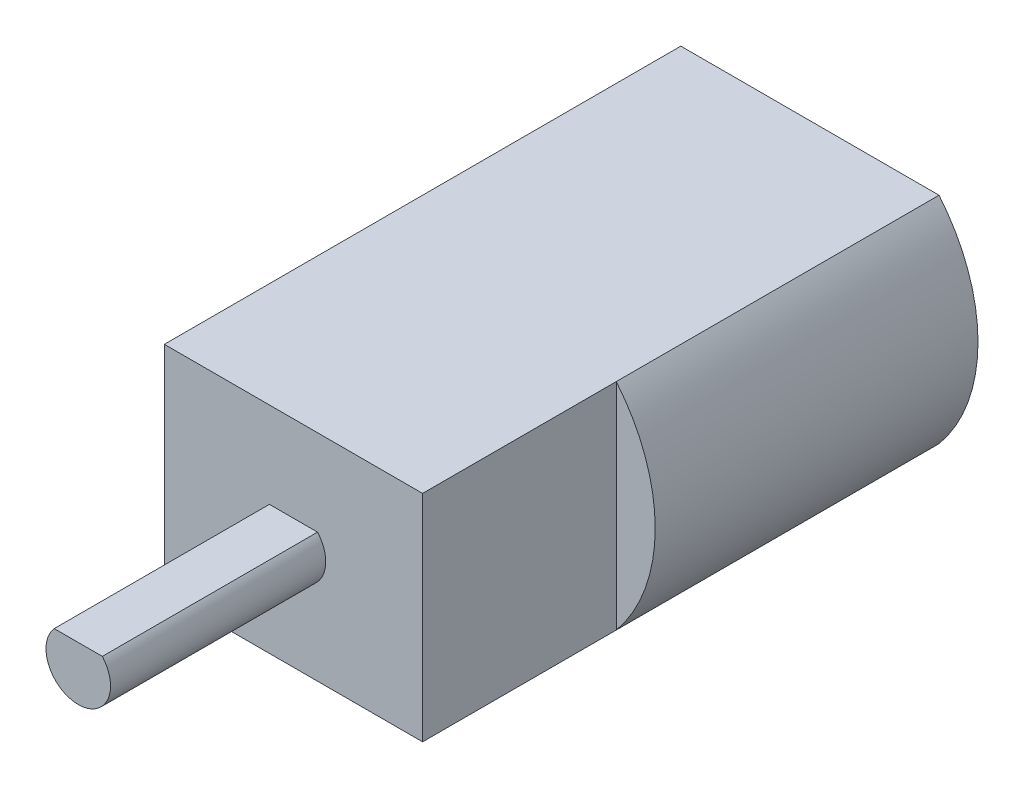
from build123d import *

# Parameters (mm, degrees)
BOSS_EXTRUDE1_DEPTH = 15
SKETCH1_3_R         = 2.5
BOSS_EXTRUDE2_DEPTH = 1
SKETCH2_W           = 12
SKETCH2_H           = 10
BOSS_EXTRUDE3_DEPTH = 9
BOSS_EXTRUDE4_DEPTH = 10


with BuildPart() as part:
    # Sketch1 → Boss-Extrude1 (new body)
    with BuildSketch(Plane.XY):
        with BuildLine():
            Line((-6, 5), (6, 5))
            ThreePointArc((6, 5), (7.810249676, 0), (6, -5))
            Line((6, -5), (-6, -5))
            ThreePointArc((-6, -5), (-7.810249676, 0), (-6, 5))
        make_face()
    extrude(amount=BOSS_EXTRUDE1_DEPTH)

    # Sketch1<3> → Boss-Extrude2 (add)
    with BuildSketch(Plane.XY):
        Circle(SKETCH1_3_R)
    extrude(amount=-BOSS_EXTRUDE2_DEPTH)

    # Sketch2 → Boss-Extrude3 (add)
    with BuildSketch(Plane.XY.offset(15)):
        Rectangle(SKETCH2_W, SKETCH2_H)
    extrude(amount=BOSS_EXTRUDE3_DEPTH)

    # Sketch3 → Boss-Extrude4 (add)
    with BuildSketch(Plane.XY.offset(24)):
        with BuildLine():
            Line((-1.118033989, 1), (1.118033989, 1))
            ThreePointArc((1.118033989, 1), (0, -1.5), (-1.118033989, 1))
        make_face()
    extrude(amount=BOSS_EXTRUDE4_DEPTH)


solid = part.part
